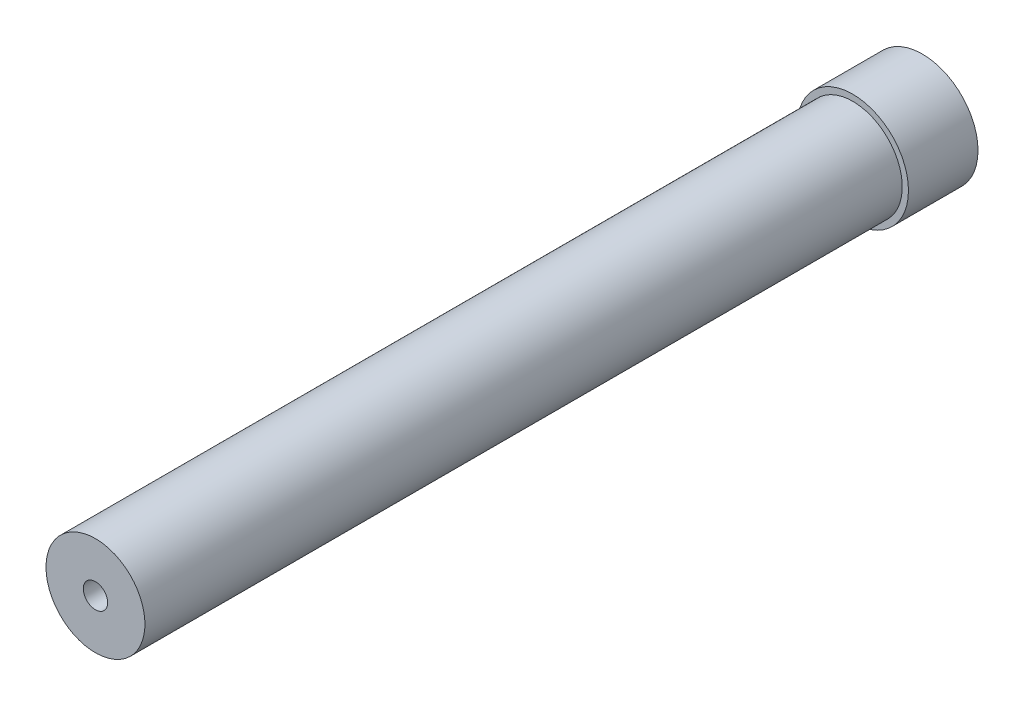
from build123d import *

# Parameters (mm, degrees)
SKETCH2_R             = 9.144
THICKER_SECTION_DEPTH = 11.43
SKETCH3_R             = 8.128
SMALLER_SECTION_DEPTH = 124.46
SKETCH4_R             = 2
CUT_EXTRUDE1_DEPTH    = 19.05


with BuildPart() as part:
    # Sketch2 → Thicker Section (new body)
    with BuildSketch(Plane.XY):
        Circle(SKETCH2_R)
    extrude(amount=THICKER_SECTION_DEPTH)

    # Sketch3 → Smaller  Section (add)
    with BuildSketch(Plane.XY.offset(11.43)):
        Circle(SKETCH3_R)
    extrude(amount=SMALLER_SECTION_DEPTH)

    # Sketch4 → Cut-Extrude1 (cut)
    with BuildSketch(Plane.XY.offset(135.89)):
        Circle(SKETCH4_R)
    extrude(amount=-CUT_EXTRUDE1_DEPTH, mode=Mode.SUBTRACT)


solid = part.part
